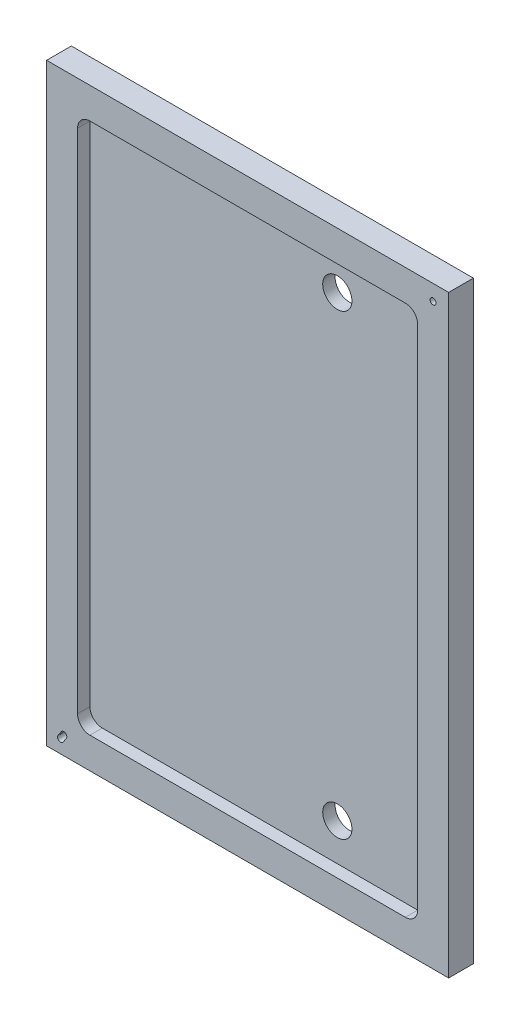
from build123d import *

# Parameters (mm, degrees)
SKETCH1_W                      = 206.375
SKETCH1_H                      = 304.8
BOSS_EXTRUDE1_DEPTH            = 12.7
CUT_EXTRUDE1_DEPTH             = 6.35
SKETCH4_R                      = 7.5
CUT_EXTRUDE3_DEPTH             = 185.484986262
F_3_1_3_1_DIAMETER_HOLE1_D     = 3.1
F_3_1_3_1_DIAMETER_HOLE1_DEPTH = 5
F_3_1_3_1_DIAMETER_HOLE1_TIP   = 0.931333959
CUT_EXTRUDE4_DEPTH             = 5
M4X0_7_TAPPED_HOLE1_D          = 3.3
M4X0_7_TAPPED_HOLE1_DEPTH      = 5.4
M4X0_7_TAPPED_HOLE1_TIP        = 0.991420021


with BuildPart() as part:
    # Sketch1 → Boss-Extrude1 (new body)
    with BuildSketch(Plane.XY):
        Rectangle(SKETCH1_W, SKETCH1_H)
    extrude(amount=BOSS_EXTRUDE1_DEPTH)

    # Sketch2 → Cut-Extrude1 (cut)
    with BuildSketch(Plane.XY.offset(12.7)):
        with BuildLine():
            Line((80.9625, -136.525), (-80.9625, -136.525))
            ThreePointArc((-80.9625, -136.525), (-85.452628061, -134.665128061), (-87.3125, -130.175))
            Line((-87.3125, -130.175), (-87.3125, 130.175))
            ThreePointArc((-87.3125, 130.175), (-85.452628061, 134.665128061), (-80.9625, 136.525))
            Line((-80.9625, 136.525), (80.9625, 136.525))
            ThreePointArc((80.9625, 136.525), (85.452628061, 134.665128061), (87.3125, 130.175))
            Line((87.3125, 130.175), (87.3125, -130.175))
            ThreePointArc((87.3125, -130.175), (85.452628061, -134.665128061), (80.9625, -136.525))
        make_face()
    extrude(amount=-CUT_EXTRUDE1_DEPTH, mode=Mode.SUBTRACT)

    # Sketch4 → Cut-Extrude3 (cut, through all)
    with BuildSketch(Plane(origin=(0, 0, 0), x_dir=(-1, 0, 0), z_dir=(0, 0, -1))):
        with Locations((-39.6875, -117.4)):
            Circle(SKETCH4_R)
        with Locations((-39.6875, 117.4)):
            Circle(SKETCH4_R)
    extrude(amount=-CUT_EXTRUDE3_DEPTH, mode=Mode.SUBTRACT)

    # Ø3.1 (3.1) Diameter Hole1
    with Locations(Plane.XY.offset(12.7)):
        with Locations((95.1875, 144.4)):
            Hole(F_3_1_3_1_DIAMETER_HOLE1_D / 2, depth=F_3_1_3_1_DIAMETER_HOLE1_DEPTH)
            with Locations((0, 0, -(F_3_1_3_1_DIAMETER_HOLE1_DEPTH + F_3_1_3_1_DIAMETER_HOLE1_TIP / 2))):  # 118° drill point
                Cone(0, F_3_1_3_1_DIAMETER_HOLE1_D / 2, F_3_1_3_1_DIAMETER_HOLE1_TIP, mode=Mode.SUBTRACT)

    # Sketch9 → Cut-Extrude4 (cut)
    with BuildSketch(Plane.XY.offset(12.7)):
        with BuildLine():
            Line((-97.307928502, -144.795326406), (-95.652117546, -142.29366894))
            ThreePointArc((-95.652117546, -142.29366894), (-93.504092195, -141.856648243), (-93.067071498, -144.004673594))
            Line((-93.067071498, -144.004673594), (-94.722882454, -146.50633106))
            ThreePointArc((-94.722882454, -146.50633106), (-96.870907805, -146.943351757), (-97.307928502, -144.795326406))
        make_face()
    extrude(amount=-CUT_EXTRUDE4_DEPTH, mode=Mode.SUBTRACT)

    # M4x0.7 Tapped Hole1
    with Locations(Plane(origin=(0, 0, 0), x_dir=(-1, 0, 0), z_dir=(0, 0, -1))):
        with Locations((95.1875, -113.6), (95.1875, 113.6)):
            Hole(M4X0_7_TAPPED_HOLE1_D / 2, depth=M4X0_7_TAPPED_HOLE1_DEPTH)
            with Locations((0, 0, -(M4X0_7_TAPPED_HOLE1_DEPTH + M4X0_7_TAPPED_HOLE1_TIP / 2))):  # 118° drill point
                Cone(0, M4X0_7_TAPPED_HOLE1_D / 2, M4X0_7_TAPPED_HOLE1_TIP, mode=Mode.SUBTRACT)


solid = part.part
